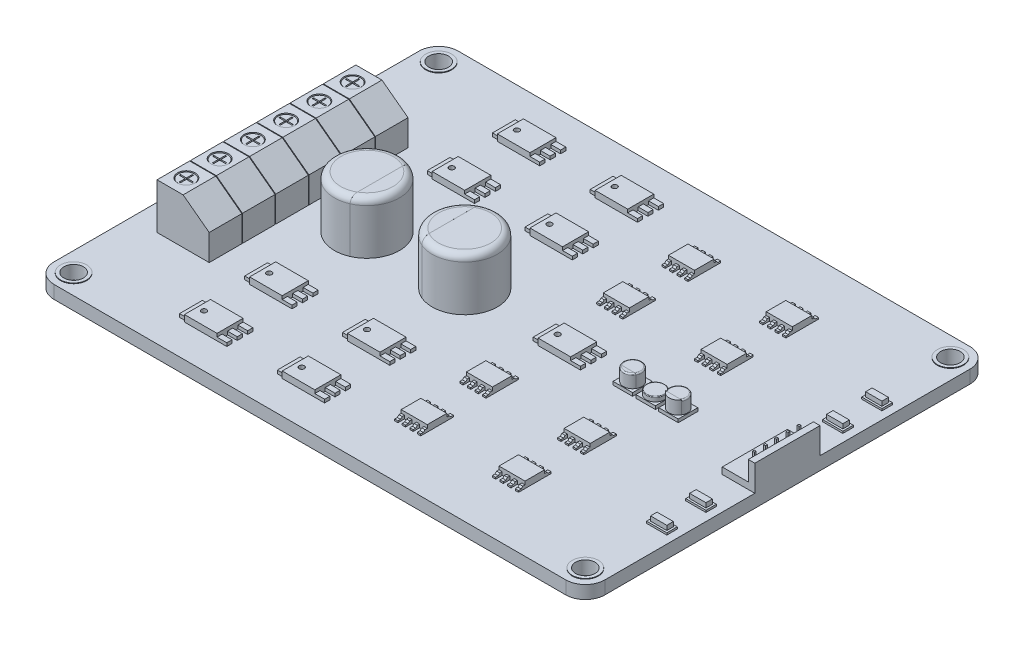
from build123d import *

# Parameters (mm, degrees)
SKETCH1_R                  = 1.5000000000000042
BOSS_EXTRUDE1_DEPTH        = 2
BOSS_EXTRUDE3_DEPTH        = 5
SKETCH9_R                  = 1.349999999999997
SKETCH9_R_2                = 1.2499999999999978
CUT_EXTRUDE2_DEPTH         = 2.5
SKETCH9_4_R                = 1.2499999999999978
CUT_EXTRUDE4_DEPTH         = 0.1
SKETCH9_3_W                = 2
SKETCH9_3_H                = 0.19999999999999973
CUT_EXTRUDE3_DEPTH         = 0.5
LPATTERN1_COUNT            = 3
LPATTERN1_PITCH            = 5.1
LPATTERN2_COUNT            = 4
LPATTERN2_PITCH            = 5.1
SKETCH10_R                 = 2.0000000000000036
SKETCH10_R_2               = 1.5000000000000042
BOSS_EXTRUDE4_DEPTH        = 0.1
SKETCH11_R                 = 5.000000000000001
SKETCH11_R_2               = 5
BOSS_EXTRUDE5_DEPTH        = 8
FILLET1_R                  = 1
SKETCH12_W                 = 5
SKETCH12_H                 = 4
SKETCH12_R                 = 0.4000000000000015
BOSS_EXTRUDE6_DEPTH        = 1
SKETCH12_3_W               = 1.5
SKETCH12_3_H               = 0.8009826220183172
SKETCH12_3_H_2             = 0.8000000000000007
BOSS_EXTRUDE7_DEPTH        = 0.5
SKETCH13_W                 = 3.5
SKETCH13_H                 = 0.5025199044534929
BOSS_EXTRUDE8_DEPTH        = 1
LPATTERN3_COUNT            = 2
LPATTERN3_PITCH            = 10
LPATTERN3_COUNT_DIR2       = 2
LPATTERN3_PITCH_DIR2       = 15
CUT_EXTRUDE5_START         = -8
CUT_EXTRUDE5_DEPTH         = 8
BOSS_EXTRUDE9_DEPTH        = 8
FILLET2_R                  = 1
SKETCH16_R                 = 0.3999999999999995
BOSS_EXTRUDE10_DEPTH       = 1
BOSS_EXTRUDE11_DEPTH       = 0.5
BOSS_EXTRUDE12_DEPTH       = 1
BOSS_EXTRUDE13_DEPTH       = 1
SKETCH18_3_W               = 0.5000000000000018
SKETCH18_3_H               = 1.0000000000000018
SKETCH18_3_W_2             = 0.5
SKETCH18_3_W_3             = 0.5000000000000027
SKETCH18_3_H_2             = 1.0000000000000036
SKETCH18_3_H_3             = 1
BOSS_EXTRUDE14_DEPTH       = 0.5
CUT_EXTRUDE6_REACH         = 62.725
LPATTERN4_COUNT            = 2
LPATTERN4_PITCH            = 10
LPATTERN4_COUNT_DIR2       = 2
LPATTERN4_PITCH_DIR2       = 15
SKETCH20_W                 = 3
SKETCH20_H                 = 3
BOSS_EXTRUDE15_DEPTH       = 0.5
LPATTERN5_COUNT            = 3
LPATTERN5_PITCH            = 3.5
SKETCH21_R                 = 1.399999999999999
BOSS_EXTRUDE16_DEPTH       = 2
CUT_EXTRUDE7_START         = -2
CUT_EXTRUDE7_DEPTH         = 2
BOSS_EXTRUDE17_START       = -2
BOSS_EXTRUDE17_DEPTH       = 2
FILLET3_R                  = 0.2
FILLET4_R                  = 0.2
LPATTERN6_COUNT            = 2
LPATTERN6_PITCH            = 7
FILLET4_OF_LPATTERN6_R     = 0.2
SKETCH24_R                 = 1.399999999999999
BOSS_EXTRUDE18_DEPTH       = 0.7
FILLET5_R                  = 0.1
SKETCH25_W                 = 4.999999999999993
SKETCH25_H                 = 10
BOSS_EXTRUDE19_DEPTH       = 1
SKETCH26_W                 = 1
SKETCH26_H                 = 9.999999999999996
BOSS_EXTRUDE20_DEPTH       = 3
SKETCH27_W                 = 0.29999999999999716
SKETCH27_H                 = 0.3000000000000016
SKETCH27_W_2               = 0.30000000000000426
SKETCH27_H_2               = 0.30000000000000226
SKETCH27_H_3               = 0.30000000000000204
SKETCH27_H_4               = 0.30000000000000293
BOSS_EXTRUDE21_DEPTH       = 3
SKETCH28_W                 = 2.5
SKETCH28_H                 = 1
BOSS_EXTRUDE22_DEPTH       = 1
SKETCH29_W                 = 3.1000000000000085
SKETCH29_H                 = 1.5999999999999979
BOSS_EXTRUDE23_DEPTH       = 0.3
LPATTERN7_COUNT            = 2
LPATTERN7_PITCH            = 6
MIRROR1_COPY_1_SKETCH_W    = 5
MIRROR1_COPY_1_SKETCH_H    = 4
MIRROR1_COPY_1_SKETCH_R    = 0.4000000000000015
MIRROR1_COPY_1_DEPTH       = 1
MIRROR1_COPY_2_SKETCH_W    = 5
MIRROR1_COPY_2_SKETCH_H    = 4
MIRROR1_COPY_2_SKETCH_R    = 0.4000000000000015
MIRROR1_COPY_2_DEPTH       = 1
MIRROR1_COPY_3_SKETCH_W    = 5
MIRROR1_COPY_3_SKETCH_H    = 4
MIRROR1_COPY_3_SKETCH_R    = 0.4000000000000015
MIRROR1_COPY_3_DEPTH       = 1
MIRROR1_COPY_4_SKETCH_W    = 1.5
MIRROR1_COPY_4_SKETCH_H    = 0.8009826220183172
MIRROR1_COPY_4_SKETCH_H_2  = 0.8000000000000007
MIRROR1_COPY_4_DEPTH       = 0.5
MIRROR1_COPY_5_SKETCH_W    = 1.5
MIRROR1_COPY_5_SKETCH_H    = 0.8009826220183172
MIRROR1_COPY_5_SKETCH_H_2  = 0.8000000000000007
MIRROR1_COPY_5_DEPTH       = 0.5
MIRROR1_COPY_6_SKETCH_W    = 1.5
MIRROR1_COPY_6_SKETCH_H    = 0.8009826220183172
MIRROR1_COPY_6_SKETCH_H_2  = 0.8000000000000007
MIRROR1_COPY_6_DEPTH       = 0.5
MIRROR1_COPY_7_SKETCH_W    = 3.5
MIRROR1_COPY_7_SKETCH_H    = 0.5025199044534929
MIRROR1_COPY_7_DEPTH       = 1
MIRROR1_COPY_8_SKETCH_W    = 3.5
MIRROR1_COPY_8_SKETCH_H    = 0.5025199044534929
MIRROR1_COPY_8_DEPTH       = 1
MIRROR1_COPY_9_SKETCH_W    = 3.5
MIRROR1_COPY_9_SKETCH_H    = 0.5025199044534929
MIRROR1_COPY_9_DEPTH       = 1
MIRROR1_COPY_10_DEPTH      = 1
MIRROR1_COPY_11_DEPTH      = 1
MIRROR1_COPY_12_DEPTH      = 1
MIRROR1_COPY_13_SKETCH_W   = 0.5000000000000018
MIRROR1_COPY_13_SKETCH_H   = 1.0000000000000018
MIRROR1_COPY_13_SKETCH_W_2 = 0.5
MIRROR1_COPY_13_SKETCH_W_3 = 0.5000000000000027
MIRROR1_COPY_13_SKETCH_H_2 = 1.0000000000000036
MIRROR1_COPY_13_SKETCH_H_3 = 1
MIRROR1_COPY_13_DEPTH      = 0.5
MIRROR1_COPY_14_SKETCH_W   = 0.5000000000000018
MIRROR1_COPY_14_SKETCH_H   = 1.0000000000000018
MIRROR1_COPY_14_SKETCH_W_2 = 0.5
MIRROR1_COPY_14_SKETCH_W_3 = 0.5000000000000027
MIRROR1_COPY_14_SKETCH_H_2 = 1.0000000000000036
MIRROR1_COPY_14_SKETCH_H_3 = 1
MIRROR1_COPY_14_DEPTH      = 0.5
MIRROR1_COPY_15_SKETCH_W   = 0.5000000000000018
MIRROR1_COPY_15_SKETCH_H   = 1.0000000000000018
MIRROR1_COPY_15_SKETCH_W_2 = 0.5
MIRROR1_COPY_15_SKETCH_W_3 = 0.5000000000000027
MIRROR1_COPY_15_SKETCH_H_2 = 1.0000000000000036
MIRROR1_COPY_15_SKETCH_H_3 = 1
MIRROR1_COPY_15_DEPTH      = 0.5
MIRROR1_COPY_16_REACH      = 62.725
MIRROR1_COPY_17_REACH      = 62.725
MIRROR1_COPY_18_REACH      = 62.725
MIRROR1_COPY_19_SKETCH_W   = 2.5
MIRROR1_COPY_19_SKETCH_H   = 1
MIRROR1_COPY_19_DEPTH      = 1
MIRROR1_COPY_20_SKETCH_W   = 3.1000000000000085
MIRROR1_COPY_20_SKETCH_H   = 1.5999999999999979
MIRROR1_COPY_20_DEPTH      = 0.3


# Read off the part's stored shape, not the designer's step: Boss-Extrude17
with BuildPart() as part:
    # Sketch1 → Boss-Extrude1 (new body)
    with BuildSketch(Plane(origin=(0, 0, 0), x_dir=(1, 0, 0), z_dir=(0, 1, 0))):
        with BuildLine():
            Line((39.250000000000014, -31), (-39.249999999999986, -31.000000000000014))
            ThreePointArc((-39.249999999999986, -31.000000000000014), (-41.37132034355963, -30.121320343559656), (-42.249999999999986, -28.00000000000001))
            Line((-42.249999999999986, -28.00000000000001), (-42.249999999999986, 27.99999999999999))
            ThreePointArc((-42.249999999999986, 27.99999999999999), (-41.371320343559624, 30.12132034355963), (-39.249999999999986, 30.999999999999986))
            Line((-39.249999999999986, 30.999999999999986), (39.250000000000014, 31))
            ThreePointArc((39.250000000000014, 31), (41.37132034355966, 30.121320343559645), (42.250000000000014, 28.000000000000004))
            Line((42.250000000000014, 28.000000000000004), (42.25000000000001, -27.999999999999996))
            ThreePointArc((42.25000000000001, -27.999999999999996), (41.37132034355966, -30.121320343559642), (39.250000000000014, -31))
        make_face()
        with Locations(Location((-39.24999999999999, 28, 0), (0, 0, 270))):
            Circle(SKETCH1_R, mode=Mode.SUBTRACT)
        with Locations(Location((39.25000000000001, 28, 0), (0, 0, 270))):
            Circle(SKETCH1_R, mode=Mode.SUBTRACT)
        with Locations(Location((39.25000000000001, -28, 0), (0, 0, 270))):
            Circle(SKETCH1_R, mode=Mode.SUBTRACT)
        with Locations(Location((-39.24999999999999, -28, 0), (0, 0, 270))):
            Circle(SKETCH1_R, mode=Mode.SUBTRACT)
    extrude(amount=BOSS_EXTRUDE1_DEPTH)

    # Sketch8 → Boss-Extrude3 (add)
    with BuildSketch(Plane.XY.offset(1)):
        Polygon((-38.24999999999999, 2), (-38.24999999999999, 9.000000000000002), (-34.249999999999986, 9.000000000000002), (-30.249999999999993, 6), (-30.249999999999993, 2), align=None)
    boss_extrude3 = extrude(amount=BOSS_EXTRUDE3_DEPTH)

    # Sketch9 → Cut-Extrude2 (cut)
    with BuildSketch(Plane(origin=(0, 9.000000000000002, 0), x_dir=(1, 0, 0), z_dir=(0, 1, 0))):
        with Locations(Location((-36.24999999999999, -3.5, 0), (0, 0, 270))):
            Circle(SKETCH9_R)
        with Locations(Location((-36.24999999999999, -3.5, 0), (0, 0, 270))):
            Circle(SKETCH9_R_2, mode=Mode.SUBTRACT)
    cut_extrude2 = extrude(amount=-CUT_EXTRUDE2_DEPTH, mode=Mode.SUBTRACT)

    # Sketch9<4> → Cut-Extrude4 (cut)
    with BuildSketch(Plane(origin=(0, 9.000000000000002, 0), x_dir=(1, 0, 0), z_dir=(0, 1, 0))):
        with Locations(Location((-36.24999999999999, -3.5, 0), (0, 0, 270))):
            Circle(SKETCH9_4_R)
    cut_extrude4 = extrude(amount=-CUT_EXTRUDE4_DEPTH, mode=Mode.SUBTRACT)

    # Sketch9<3> → Cut-Extrude3 (cut)
    with BuildSketch(Plane(origin=(0, 9.000000000000002, 0), x_dir=(1, 0, 0), z_dir=(0, 1, 0))):
        Polygon((-36.149999999999984, -4.500000000000001), (-36.149999999999984, -3.5), (-36.149999999999984, -2.5), (-36.349999999999994, -2.5), (-36.349999999999994, -3.5), (-36.349999999999994, -4.500000000000001), align=None)
        with Locations((-36.24999999999999, -3.5)):
            Rectangle(SKETCH9_3_W, SKETCH9_3_H)
    cut_extrude3 = extrude(amount=-CUT_EXTRUDE3_DEPTH, mode=Mode.SUBTRACT)

    # LPattern1: Boss-Extrude3, Cut-Extrude2, Cut-Extrude4, Cut-Extrude3 ×3
    with Locations(*[(0, 0, i * LPATTERN1_PITCH) for i in range(1, LPATTERN1_COUNT)]):
        add(boss_extrude3)
        add(cut_extrude2, mode=Mode.SUBTRACT)
        add(cut_extrude4, mode=Mode.SUBTRACT)
        add(cut_extrude3, mode=Mode.SUBTRACT)

    # LPattern2: Boss-Extrude3, Cut-Extrude2, Cut-Extrude4, Cut-Extrude3 ×4
    with Locations(*[(0, 0, -i * LPATTERN2_PITCH) for i in range(1, LPATTERN2_COUNT)]):
        add(boss_extrude3)
        add(cut_extrude2, mode=Mode.SUBTRACT)
        add(cut_extrude4, mode=Mode.SUBTRACT)
        add(cut_extrude3, mode=Mode.SUBTRACT)

    # Sketch10 → Boss-Extrude4 (add)
    # profile 1 of 4: a face of its own
    with BuildSketch(Plane(origin=(0, 2, 0), x_dir=(1, 0, 0), z_dir=(0, 1, 0))):
        with Locations(Location((-39.24999999999999, 28, 0), (0, 0, 90))):
            Circle(SKETCH10_R)
        with Locations(Location((-39.24999999999999, 28, 0), (0, 0, 270))):
            Circle(SKETCH10_R_2, mode=Mode.SUBTRACT)
    # profile 2 of 4: a face of its own
    with BuildSketch(Plane(origin=(0, 2, 0), x_dir=(1, 0, 0), z_dir=(0, 1, 0))):
        with Locations(Location((39.25000000000001, 28, 0), (0, 0, 90))):
            Circle(SKETCH10_R)
        with Locations(Location((39.25000000000001, 28, 0), (0, 0, 270))):
            Circle(SKETCH10_R_2, mode=Mode.SUBTRACT)
    # profile 3 of 4: a face of its own
    with BuildSketch(Plane(origin=(0, 2, 0), x_dir=(1, 0, 0), z_dir=(0, 1, 0))):
        with Locations(Location((39.25000000000001, -28, 0), (0, 0, 90))):
            Circle(SKETCH10_R)
        with Locations(Location((39.25000000000001, -28, 0), (0, 0, 270))):
            Circle(SKETCH10_R_2, mode=Mode.SUBTRACT)
    # profile 4 of 4: a face of its own
    with BuildSketch(Plane(origin=(0, 2, 0), x_dir=(1, 0, 0), z_dir=(0, 1, 0))):
        with Locations(Location((-39.24999999999999, -28, 0), (0, 0, 90))):
            Circle(SKETCH10_R)
        with Locations(Location((-39.24999999999999, -28, 0), (0, 0, 270))):
            Circle(SKETCH10_R_2, mode=Mode.SUBTRACT)
    extrude(amount=BOSS_EXTRUDE4_DEPTH)

    # Sketch11 → Boss-Extrude5 (add)
    with BuildSketch(Plane(origin=(0, 2, 0), x_dir=(1, 0, 0), z_dir=(0, 1, 0))):
        with Locations(Location((-22.249999999999982, 0, 0), (0, 0, 90))):
            Circle(SKETCH11_R)
        with Locations(Location((-7.249999999999982, 0, 0), (0, 0, 90))):
            Circle(SKETCH11_R_2)
    extrude(amount=BOSS_EXTRUDE5_DEPTH)

    # Fillet1
    fillet1_edges = [part.edges().sort_by_distance(p)[0] for p in [
        (-22.249999999999982, 10, 5.000000000000001),
        (-7.249999999999983, 10, 5),
    ]]
    fillet(fillet1_edges, radius=FILLET1_R)

    # Sketch12 → Boss-Extrude6 (add)
    with BuildSketch(Plane(origin=(0, 2, 0), x_dir=(1, 0, 0), z_dir=(0, 1, 0))):
        with Locations((-21.749999999999982, -14.000000000000014)):
            Rectangle(SKETCH12_W, SKETCH12_H)
        with Locations(Location((-23.249999999999982, -14.000000000000014, 0), (0, 0, 270))):
            Circle(SKETCH12_R, mode=Mode.SUBTRACT)
    boss_extrude6 = extrude(amount=BOSS_EXTRUDE6_DEPTH)

    # Sketch12<3> → Boss-Extrude7 (add)
    with BuildSketch(Plane(origin=(0, 2, 0), x_dir=(1, 0, 0), z_dir=(0, 1, 0))):
        with Locations((-18.499999999999982, -12.400491311009173)):
            Rectangle(SKETCH12_3_W, SKETCH12_3_H)
        Polygon((-19.249999999999982, -13.600982622018332), (-19.249999999999982, -14.400982622018333), (-17.749999999999986, -14.400982622018333), (-17.749999999999982, -13.600982622018332), align=None)
        with Locations((-18.499999999999982, -15.600000000000014)):
            Rectangle(SKETCH12_3_W, SKETCH12_3_H_2)
    boss_extrude7 = extrude(amount=BOSS_EXTRUDE7_DEPTH)

    # Sketch13 → Boss-Extrude8 (add)
    with BuildSketch(Plane.ZY.offset(24.249999999999982)):
        with Locations((14.000000000000014, 2.2512599522267465)):
            Rectangle(SKETCH13_W, SKETCH13_H)
    boss_extrude8 = extrude(amount=BOSS_EXTRUDE8_DEPTH)

    # LPattern3: Boss-Extrude6, Boss-Extrude7, Boss-Extrude8 2 × 2
    with Locations(*[(j * LPATTERN3_PITCH_DIR2, 0, i * LPATTERN3_PITCH) for i in range(LPATTERN3_COUNT) for j in range(LPATTERN3_COUNT_DIR2) if (i, j) != (0, 0)]):
        add(boss_extrude6)
        add(boss_extrude7)
        add(boss_extrude8)

    # Sketch14 → Cut-Extrude5 (cut)
    with BuildSketch(Plane(origin=(0, 10, 0), x_dir=(1, 0, 0), z_dir=(0, 1, 0)).offset(CUT_EXTRUDE5_START)):
        with BuildLine():
            ThreePointArc((-20.249999999999982, -4.582575694955841), (-17.249999999999982, 2.2e-16), (-20.249999999999982, 4.582575694955841))
            Line((-20.249999999999982, 4.582575694955842), (-20.249999999999982, -4.582575694955842))
        make_face()
        with BuildLine():
            Line((-9.249999999999979, -4.582575694955842), (-9.249999999999979, 4.582575694955842))
            ThreePointArc((-9.249999999999979, 4.582575694955842), (-12.249999999999982, 6.1e-16), (-9.249999999999979, -4.582575694955842))
        make_face()
    extrude(amount=CUT_EXTRUDE5_DEPTH, mode=Mode.SUBTRACT)

    # Sketch15 → Boss-Extrude9 (add)
    with BuildSketch(Plane(origin=(0, 2, 0), x_dir=(1, 0, 0), z_dir=(0, 1, 0))):
        with BuildLine():
            ThreePointArc((-17.249999999999982, 0), (-18.06640107084818, 2.7381563140185943), (-20.248999999999942, 4.582139129271375))
            Line((-20.24899999999998, 4.582139129271363), (-20.24899999999998, -4.582139129271362))
            ThreePointArc((-20.248999999999945, -4.5821391292713765), (-18.06640107084818, -2.738156314018595), (-17.249999999999982, -1.22e-15))
        make_face()
        with BuildLine():
            Line((-9.250999999999976, -4.58213912927144), (-9.250999999999978, 4.582139129271438))
            ThreePointArc((-9.250999999999923, 4.582139129271419), (-12.249999999999982, 6.1e-16), (-9.25099999999992, -4.58213912927142))
        make_face()
    extrude(amount=BOSS_EXTRUDE9_DEPTH)

    # Fillet2
    fillet2_edges = [part.edges().sort_by_distance(p)[0] for p in [
        (-17.249999999999982, 10, 3.11e-15),
        (-12.249999999999982, 10, 1.11e-15),
    ]]
    fillet(fillet2_edges, radius=FILLET2_R)

    # Sketch16 → Boss-Extrude10 (add)
    with BuildSketch(Plane(origin=(0, 2, 0), x_dir=(1, 0, 0), z_dir=(0, 1, 0))):
        Polygon((6, -2), (11.000000000000002, -2), (11.000000000000002, 2.0000000000000018), (5.999999999999999, 2), align=None)
        with Locations(Location((7, 0, 0), (0, 0, 270))):
            Circle(SKETCH16_R, mode=Mode.SUBTRACT)
    extrude(amount=BOSS_EXTRUDE10_DEPTH)

    # Sketch16<3> → Boss-Extrude11 (add)
    with BuildSketch(Plane(origin=(0, 2, 0), x_dir=(1, 0, 0), z_dir=(0, 1, 0))):
        Polygon((12.5, 2.0000000000000027), (11.000000000000002, 2.0000000000000018), (11.000000000000002, 1.200000000000002), (12.5, 1.2000000000000026), align=None)
        Polygon((11.000000000000002, 0.400000000000003), (11.000000000000002, -0.39999999999999725), (12.5, -0.39999999999999714), (12.5, 0.4000000000000028), align=None)
        Polygon((11.000000000000002, -1.1999999999999973), (11.000000000000002, -2), (12.5, -2), (12.5, -1.1999999999999966), align=None)
    extrude(amount=BOSS_EXTRUDE11_DEPTH)

    # Sketch17 → Boss-Extrude12 (add)
    with BuildSketch(Plane.ZY.offset(-6)):
        Polygon((-1.7500000000000002, 1.9999999999999996), (1.7500000000000002, 1.9999999999999996), (1.7500000000000002, 2.4999999999999996), (-1.7499999999999998, 2.4999999999999996), align=None)
    extrude(amount=BOSS_EXTRUDE12_DEPTH)

    # Sketch18 → Boss-Extrude13 (add)
    with BuildSketch(Plane(origin=(0, 2, 0), x_dir=(1, 0, 0), z_dir=(0, 1, 0))):
        Polygon((9.000000000000002, -9), (9.000000000000002, -12), (5.000000000000001, -11.999999999999998), (5.000000000000001, -9), align=None)
    boss_extrude13 = extrude(amount=BOSS_EXTRUDE13_DEPTH)

    # Sketch18<3> → Boss-Extrude14 (add)
    with BuildSketch(Plane(origin=(0, 2, 0), x_dir=(1, 0, 0), z_dir=(0, 1, 0))):
        with Locations((8.75, -12.5)):
            Rectangle(SKETCH18_3_W, SKETCH18_3_H)
        with Locations((7.583333333333334, -12.5)):
            Rectangle(SKETCH18_3_W_2, SKETCH18_3_H)
        with Locations((6.413333333333334, -12.5)):
            Rectangle(SKETCH18_3_W_3, SKETCH18_3_H_2)
        with Locations((5.250000000000002, -12.5)):
            Rectangle(SKETCH18_3_W, SKETCH18_3_H_2)
        Polygon((8.5, -7.999999999999998), (8.5, -9), (9.000000000000002, -9), (9.000000000000002, -8), align=None)
        with Locations((7.583333333333334, -8.5)):
            Rectangle(SKETCH18_3_W_2, SKETCH18_3_H_3)
        Polygon((6.163333333333333, -8), (6.163333333333333, -9), (6.663333333333335, -9), (6.663333333333334, -8), align=None)
        Polygon((5.000000000000001, -8), (5.000000000000001, -9), (5.500000000000003, -9), (5.500000000000002, -8), align=None)
    boss_extrude14 = extrude(amount=BOSS_EXTRUDE14_DEPTH)

    # Cut-Extrude6: up to this face of the body (flat: up to its plane)
    cut_extrude6_end = Plane(part.part.faces().sort_by_distance((5, 2.25, 0))[0])
    # Sketch19 → Cut-Extrude6 (cut, up to the picked face)
    with BuildSketch(Plane(origin=(9.000000000000002, 0, 0), x_dir=(0, 0, -1), z_dir=(1, 0, 0)), mode=Mode.PRIVATE) as cut_extrude6_sk1:
        Polygon((-12.347582855807117, 2.499999999999999), (-13, 2.5), (-13, 2.2500000000000004), (-12.597582855807117, 2.2500000000000004), align=None)
    cut_extrude6_tool1 = split(extrude(cut_extrude6_sk1.sketch, amount=-CUT_EXTRUDE6_REACH, mode=Mode.PRIVATE), bisect_by=cut_extrude6_end, keep=Keep.BOTH, mode=Mode.PRIVATE)
    # Sketch19 → Cut-Extrude6 (cut, up to the picked face)
    with BuildSketch(Plane(origin=(9.000000000000002, 0, 0), x_dir=(0, 0, -1), z_dir=(1, 0, 0)), mode=Mode.PRIVATE) as cut_extrude6_sk2:
        Polygon((-8.652417144192881, 2.499999999999999), (-8.40241714419288, 2.250000000000001), (-7.999999999999998, 2.250000000000001), (-8, 2.5000000000000013), align=None)
    cut_extrude6_tool2 = split(extrude(cut_extrude6_sk2.sketch, amount=-CUT_EXTRUDE6_REACH, mode=Mode.PRIVATE), bisect_by=cut_extrude6_end, keep=Keep.BOTH, mode=Mode.PRIVATE)
    cut_extrude6_1 = cut_extrude6_tool1.solids().sort_by(Axis((9, 2.384875, 12.731354), (-1, 0, 0)))[0]
    add(cut_extrude6_1, mode=Mode.SUBTRACT)
    cut_extrude6_2 = cut_extrude6_tool2.solids().sort_by(Axis((9, 2.384875, 8.268646), (-1, 0, 0)))[0]
    add(cut_extrude6_2, mode=Mode.SUBTRACT)
    cut_extrude6 = cut_extrude6_1 + cut_extrude6_2  # Cut-Extrude6 as one shape, for the pattern or mirror that repeats it

    # LPattern4: Boss-Extrude13, Boss-Extrude14, Cut-Extrude6 2 × 2
    with Locations(*[(j * LPATTERN4_PITCH_DIR2, 0, i * LPATTERN4_PITCH) for i in range(LPATTERN4_COUNT) for j in range(LPATTERN4_COUNT_DIR2) if (i, j) != (0, 0)]):
        add(boss_extrude13)
        add(boss_extrude14)
        add(cut_extrude6, mode=Mode.SUBTRACT)

    # Sketch20 → Boss-Extrude15 (add)
    with BuildSketch(Plane(origin=(0, 2, 0), x_dir=(1, 0, 0), z_dir=(0, 1, 0))):
        with Locations((18.5, 0)):
            Rectangle(SKETCH20_W, SKETCH20_H)
    boss_extrude15 = extrude(amount=BOSS_EXTRUDE15_DEPTH)

    # LPattern5: Boss-Extrude15 ×3
    with Locations(*[(i * LPATTERN5_PITCH, 0, 0) for i in range(1, LPATTERN5_COUNT)]):
        add(boss_extrude15)

    # Sketch21 → Boss-Extrude16 (add)
    with BuildSketch(Plane(origin=(0, 2.5, 0), x_dir=(1, 0, 0), z_dir=(0, 1, 0))):
        with Locations(Location((18.5, 0, 0), (0, 0, 270))):
            Circle(SKETCH21_R)
    boss_extrude16 = extrude(amount=BOSS_EXTRUDE16_DEPTH)

    # Sketch22 → Cut-Extrude7 (cut)
    with BuildSketch(Plane(origin=(0, 4.500000000000001, 0), x_dir=(1, 0, 0), z_dir=(0, 1, 0)).offset(CUT_EXTRUDE7_START)):
        with BuildLine():
            Line((19.71243556529821, -0.6999999999999993), (17.287564434701785, -0.6999999999999993))
            ThreePointArc((17.287564434701785, -0.6999999999999987), (18.5, -1.3999999999999992), (19.712435565298215, -0.7000000000000003))
        make_face()
    cut_extrude7 = extrude(amount=CUT_EXTRUDE7_DEPTH, mode=Mode.SUBTRACT)

    # Boss-Extrude17 outline → Boss-Extrude17 (add)
    with BuildSketch(Plane(origin=(0, 4.500000000000001, 0), x_dir=(1, 0, 0), z_dir=(0, 1, 0)).offset(BOSS_EXTRUDE17_START)):
        with BuildLine():
            Line((19.711857665, -0.701), (17.288142335, -0.701))
            ThreePointArc((17.288142335, -0.701), (18.5, -1.4), (19.711857665, -0.701))
        make_face()
    boss_extrude17 = extrude(amount=BOSS_EXTRUDE17_DEPTH)

    # Fillet3
    fillet3_edges = [part.edges().sort_by_distance(p)[0] for p in [
        (18.5, 4.500000000000001, 1.4000000000000008),
    ]]
    fillet(fillet3_edges, radius=FILLET3_R)

    # Fillet4
    fillet4_edges = [part.edges().sort_by_distance(p)[0] for p in [
        (18.5, 4.5, -1.399999999999999),
    ]]
    fillet(fillet4_edges, radius=FILLET4_R)

    # LPattern6: Boss-Extrude16, Cut-Extrude7, Boss-Extrude17 ×2
    with Locations(*[(i * LPATTERN6_PITCH, 0, 0) for i in range(1, LPATTERN6_COUNT)]):
        add(boss_extrude16)
        add(cut_extrude7, mode=Mode.SUBTRACT)
        add(boss_extrude17)

    # Fillet4 of LPattern6
    fillet4_of_lpattern6_edges = [part.edges().sort_by_distance(p)[0] for p in [
        (25.5, 4.5, -1.399999999999999),
    ]]
    fillet(fillet4_of_lpattern6_edges, radius=FILLET4_OF_LPATTERN6_R)

    # Sketch24 → Boss-Extrude18 (add)
    with BuildSketch(Plane(origin=(0, 2.5, 0), x_dir=(1, 0, 0), z_dir=(0, 1, 0))):
        with Locations(Location((22, 0, 0), (0, 0, 270))):
            Circle(SKETCH24_R)
    extrude(amount=BOSS_EXTRUDE18_DEPTH)

    # Fillet5
    fillet5_edges = [part.edges().sort_by_distance(p)[0] for p in [
        (22, 3.2, -1.399999999999999),
    ]]
    fillet(fillet5_edges, radius=FILLET5_R)

    # Sketch25 → Boss-Extrude19 (add)
    with BuildSketch(Plane(origin=(0, 2, 0), x_dir=(1, 0, 0), z_dir=(0, 1, 0))):
        with Locations((39.750000000000014, 0)):
            Rectangle(SKETCH25_W, SKETCH25_H)
    extrude(amount=BOSS_EXTRUDE19_DEPTH)

    # Sketch26 → Boss-Extrude20 (add)
    with BuildSketch(Plane(origin=(0, 3, 0), x_dir=(1, 0, 0), z_dir=(0, 1, 0))):
        with Locations((41.75000000000001, 1.33e-15)):
            Rectangle(SKETCH26_W, SKETCH26_H)
    extrude(amount=BOSS_EXTRUDE20_DEPTH)

    # Sketch27 → Boss-Extrude21 (add)
    with BuildSketch(Plane(origin=(0, 3, 0), x_dir=(1, 0, 0), z_dir=(0, 1, 0))):
        with Locations((40.60000000000001, 3.4299999999999993)):
            Rectangle(SKETCH27_W, SKETCH27_H)
        with Locations((40.60000000000002, 1.7133333333333307)):
            Rectangle(SKETCH27_W_2, SKETCH27_H_2)
        with Locations((40.60000000000004, -0.00333333333333848)):
            Rectangle(SKETCH27_W_2, SKETCH27_H_3)
        with Locations((40.600000000000065, -1.7200000000000077)):
            Rectangle(SKETCH27_W_2, SKETCH27_H_3)
        with Locations((40.60000000000008, -3.4366666666666763)):
            Rectangle(SKETCH27_W_2, SKETCH27_H_4)
    extrude(amount=BOSS_EXTRUDE21_DEPTH)

    # Sketch28 → Boss-Extrude22 (add)
    with BuildSketch(Plane(origin=(0, 2, 0), x_dir=(1, 0, 0), z_dir=(0, 1, 0))):
        with Locations((39.50000000000001, -10.5)):
            Rectangle(SKETCH28_W, SKETCH28_H)
    boss_extrude22 = extrude(amount=BOSS_EXTRUDE22_DEPTH)

    # Sketch29 → Boss-Extrude23 (add)
    with BuildSketch(Plane(origin=(0, 2, 0), x_dir=(1, 0, 0), z_dir=(0, 1, 0))):
        with Locations((39.50000000000001, -10.5)):
            Rectangle(SKETCH29_W, SKETCH29_H)
    boss_extrude23 = extrude(amount=BOSS_EXTRUDE23_DEPTH)

    # LPattern7: Boss-Extrude22, Boss-Extrude23 ×2
    with Locations(*[(0, 0, i * LPATTERN7_PITCH) for i in range(1, LPATTERN7_COUNT)]):
        add(boss_extrude22)
        add(boss_extrude23)

    # Mirror1: Boss-Extrude6, Boss-Extrude7, Boss-Extrude8, Boss-Extrude13, Boss-Extrude14, Cut-Extrude6, Boss-Extrude22, Boss-Extrude23 across plane
    add(boss_extrude6.mirror(Plane.XY))
    add(boss_extrude7.mirror(Plane.XY))
    add(boss_extrude8.mirror(Plane.XY))
    add(boss_extrude13.mirror(Plane.XY))
    add(boss_extrude14.mirror(Plane.XY))
    add(cut_extrude6.mirror(Plane.XY), mode=Mode.SUBTRACT)
    add(boss_extrude22.mirror(Plane.XY))
    add(boss_extrude23.mirror(Plane.XY))

    # Mirror1 copy 1 sketch → Mirror1 copy 1 (add)
    with BuildSketch(Plane(origin=(15, 2, 0), x_dir=(1, 0, 0), z_dir=(0, 1, 0))):
        with Locations((-21.749999999999982, 14.000000000000014)):
            Rectangle(MIRROR1_COPY_1_SKETCH_W, MIRROR1_COPY_1_SKETCH_H)
        with Locations((-23.249999999999982, 14.000000000000014)):
            Circle(MIRROR1_COPY_1_SKETCH_R, mode=Mode.SUBTRACT)
    extrude(amount=MIRROR1_COPY_1_DEPTH)

    # Mirror1 copy 2 sketch → Mirror1 copy 2 (add)
    with BuildSketch(Plane(origin=(0, 2, -10), x_dir=(1, 0, 0), z_dir=(0, 1, 0))):
        with Locations((-21.749999999999982, 14.000000000000014)):
            Rectangle(MIRROR1_COPY_2_SKETCH_W, MIRROR1_COPY_2_SKETCH_H)
        with Locations((-23.249999999999982, 14.000000000000014)):
            Circle(MIRROR1_COPY_2_SKETCH_R, mode=Mode.SUBTRACT)
    extrude(amount=MIRROR1_COPY_2_DEPTH)

    # Mirror1 copy 3 sketch → Mirror1 copy 3 (add)
    with BuildSketch(Plane(origin=(15, 2, -10), x_dir=(1, 0, 0), z_dir=(0, 1, 0))):
        with Locations((-21.749999999999982, 14.000000000000014)):
            Rectangle(MIRROR1_COPY_3_SKETCH_W, MIRROR1_COPY_3_SKETCH_H)
        with Locations((-23.249999999999982, 14.000000000000014)):
            Circle(MIRROR1_COPY_3_SKETCH_R, mode=Mode.SUBTRACT)
    extrude(amount=MIRROR1_COPY_3_DEPTH)

    # Mirror1 copy 4 sketch → Mirror1 copy 4 (add)
    with BuildSketch(Plane(origin=(15, 2, 0), x_dir=(1, 0, 0), z_dir=(0, 1, 0))):
        with Locations((-18.499999999999982, 12.400491311009173)):
            Rectangle(MIRROR1_COPY_4_SKETCH_W, MIRROR1_COPY_4_SKETCH_H)
        Polygon((-19.249999999999982, 13.600982622018332), (-19.249999999999982, 14.400982622018333), (-17.749999999999986, 14.400982622018333), (-17.749999999999982, 13.600982622018332), align=None)
        with Locations((-18.499999999999982, 15.600000000000014)):
            Rectangle(MIRROR1_COPY_4_SKETCH_W, MIRROR1_COPY_4_SKETCH_H_2)
    extrude(amount=MIRROR1_COPY_4_DEPTH)

    # Mirror1 copy 5 sketch → Mirror1 copy 5 (add)
    with BuildSketch(Plane(origin=(0, 2, -10), x_dir=(1, 0, 0), z_dir=(0, 1, 0))):
        with Locations((-18.499999999999982, 12.400491311009173)):
            Rectangle(MIRROR1_COPY_5_SKETCH_W, MIRROR1_COPY_5_SKETCH_H)
        Polygon((-19.249999999999982, 13.600982622018332), (-19.249999999999982, 14.400982622018333), (-17.749999999999986, 14.400982622018333), (-17.749999999999982, 13.600982622018332), align=None)
        with Locations((-18.499999999999982, 15.600000000000014)):
            Rectangle(MIRROR1_COPY_5_SKETCH_W, MIRROR1_COPY_5_SKETCH_H_2)
    extrude(amount=MIRROR1_COPY_5_DEPTH)

    # Mirror1 copy 6 sketch → Mirror1 copy 6 (add)
    with BuildSketch(Plane(origin=(15, 2, -10), x_dir=(1, 0, 0), z_dir=(0, 1, 0))):
        with Locations((-18.499999999999982, 12.400491311009173)):
            Rectangle(MIRROR1_COPY_6_SKETCH_W, MIRROR1_COPY_6_SKETCH_H)
        Polygon((-19.249999999999982, 13.600982622018332), (-19.249999999999982, 14.400982622018333), (-17.749999999999986, 14.400982622018333), (-17.749999999999982, 13.600982622018332), align=None)
        with Locations((-18.499999999999982, 15.600000000000014)):
            Rectangle(MIRROR1_COPY_6_SKETCH_W, MIRROR1_COPY_6_SKETCH_H_2)
    extrude(amount=MIRROR1_COPY_6_DEPTH)

    # Mirror1 copy 7 sketch → Mirror1 copy 7 (add)
    with BuildSketch(Plane(origin=(-9.249999999999982, 0, 0), x_dir=(0, 0, -1), z_dir=(-1, 0, 0))):
        with Locations((14.000000000000014, -2.2512599522267465)):
            Rectangle(MIRROR1_COPY_7_SKETCH_W, MIRROR1_COPY_7_SKETCH_H)
    extrude(amount=MIRROR1_COPY_7_DEPTH)

    # Mirror1 copy 8 sketch → Mirror1 copy 8 (add)
    with BuildSketch(Plane(origin=(-24.249999999999982, 0, -10), x_dir=(0, 0, -1), z_dir=(-1, 0, 0))):
        with Locations((14.000000000000014, -2.2512599522267465)):
            Rectangle(MIRROR1_COPY_8_SKETCH_W, MIRROR1_COPY_8_SKETCH_H)
    extrude(amount=MIRROR1_COPY_8_DEPTH)

    # Mirror1 copy 9 sketch → Mirror1 copy 9 (add)
    with BuildSketch(Plane(origin=(-9.249999999999982, 0, -10), x_dir=(0, 0, -1), z_dir=(-1, 0, 0))):
        with Locations((14.000000000000014, -2.2512599522267465)):
            Rectangle(MIRROR1_COPY_9_SKETCH_W, MIRROR1_COPY_9_SKETCH_H)
    extrude(amount=MIRROR1_COPY_9_DEPTH)

    # Mirror1 copy 10 sketch → Mirror1 copy 10 (add)
    with BuildSketch(Plane(origin=(15, 2, 0), x_dir=(1, 0, 0), z_dir=(0, 1, 0))):
        Polygon((9.000000000000002, 9), (9.000000000000002, 12), (5.000000000000001, 11.999999999999998), (5.000000000000001, 9), align=None)
    extrude(amount=MIRROR1_COPY_10_DEPTH)

    # Mirror1 copy 11 sketch → Mirror1 copy 11 (add)
    with BuildSketch(Plane(origin=(0, 2, -10), x_dir=(1, 0, 0), z_dir=(0, 1, 0))):
        Polygon((9.000000000000002, 9), (9.000000000000002, 12), (5.000000000000001, 11.999999999999998), (5.000000000000001, 9), align=None)
    extrude(amount=MIRROR1_COPY_11_DEPTH)

    # Mirror1 copy 12 sketch → Mirror1 copy 12 (add)
    with BuildSketch(Plane(origin=(15, 2, -10), x_dir=(1, 0, 0), z_dir=(0, 1, 0))):
        Polygon((9.000000000000002, 9), (9.000000000000002, 12), (5.000000000000001, 11.999999999999998), (5.000000000000001, 9), align=None)
    extrude(amount=MIRROR1_COPY_12_DEPTH)

    # Mirror1 copy 13 sketch → Mirror1 copy 13 (add)
    with BuildSketch(Plane(origin=(15, 2, 0), x_dir=(1, 0, 0), z_dir=(0, 1, 0))):
        with Locations((8.75, 12.5)):
            Rectangle(MIRROR1_COPY_13_SKETCH_W, MIRROR1_COPY_13_SKETCH_H)
        with Locations((7.583333333333334, 12.5)):
            Rectangle(MIRROR1_COPY_13_SKETCH_W_2, MIRROR1_COPY_13_SKETCH_H)
        with Locations((6.413333333333334, 12.5)):
            Rectangle(MIRROR1_COPY_13_SKETCH_W_3, MIRROR1_COPY_13_SKETCH_H_2)
        with Locations((5.250000000000002, 12.5)):
            Rectangle(MIRROR1_COPY_13_SKETCH_W, MIRROR1_COPY_13_SKETCH_H_2)
        Polygon((8.5, 7.999999999999998), (8.5, 9), (9.000000000000002, 9), (9.000000000000002, 8), align=None)
        with Locations((7.583333333333334, 8.5)):
            Rectangle(MIRROR1_COPY_13_SKETCH_W_2, MIRROR1_COPY_13_SKETCH_H_3)
        Polygon((6.163333333333333, 8), (6.163333333333333, 9), (6.663333333333335, 9), (6.663333333333334, 8), align=None)
        Polygon((5.000000000000001, 8), (5.000000000000001, 9), (5.500000000000003, 9), (5.500000000000002, 8), align=None)
    extrude(amount=MIRROR1_COPY_13_DEPTH)

    # Mirror1 copy 14 sketch → Mirror1 copy 14 (add)
    with BuildSketch(Plane(origin=(0, 2, -10), x_dir=(1, 0, 0), z_dir=(0, 1, 0))):
        with Locations((8.75, 12.5)):
            Rectangle(MIRROR1_COPY_14_SKETCH_W, MIRROR1_COPY_14_SKETCH_H)
        with Locations((7.583333333333334, 12.5)):
            Rectangle(MIRROR1_COPY_14_SKETCH_W_2, MIRROR1_COPY_14_SKETCH_H)
        with Locations((6.413333333333334, 12.5)):
            Rectangle(MIRROR1_COPY_14_SKETCH_W_3, MIRROR1_COPY_14_SKETCH_H_2)
        with Locations((5.250000000000002, 12.5)):
            Rectangle(MIRROR1_COPY_14_SKETCH_W, MIRROR1_COPY_14_SKETCH_H_2)
        Polygon((8.5, 7.999999999999998), (8.5, 9), (9.000000000000002, 9), (9.000000000000002, 8), align=None)
        with Locations((7.583333333333334, 8.5)):
            Rectangle(MIRROR1_COPY_14_SKETCH_W_2, MIRROR1_COPY_14_SKETCH_H_3)
        Polygon((6.163333333333333, 8), (6.163333333333333, 9), (6.663333333333335, 9), (6.663333333333334, 8), align=None)
        Polygon((5.000000000000001, 8), (5.000000000000001, 9), (5.500000000000003, 9), (5.500000000000002, 8), align=None)
    extrude(amount=MIRROR1_COPY_14_DEPTH)

    # Mirror1 copy 15 sketch → Mirror1 copy 15 (add)
    with BuildSketch(Plane(origin=(15, 2, -10), x_dir=(1, 0, 0), z_dir=(0, 1, 0))):
        with Locations((8.75, 12.5)):
            Rectangle(MIRROR1_COPY_15_SKETCH_W, MIRROR1_COPY_15_SKETCH_H)
        with Locations((7.583333333333334, 12.5)):
            Rectangle(MIRROR1_COPY_15_SKETCH_W_2, MIRROR1_COPY_15_SKETCH_H)
        with Locations((6.413333333333334, 12.5)):
            Rectangle(MIRROR1_COPY_15_SKETCH_W_3, MIRROR1_COPY_15_SKETCH_H_2)
        with Locations((5.250000000000002, 12.5)):
            Rectangle(MIRROR1_COPY_15_SKETCH_W, MIRROR1_COPY_15_SKETCH_H_2)
        Polygon((8.5, 7.999999999999998), (8.5, 9), (9.000000000000002, 9), (9.000000000000002, 8), align=None)
        with Locations((7.583333333333334, 8.5)):
            Rectangle(MIRROR1_COPY_15_SKETCH_W_2, MIRROR1_COPY_15_SKETCH_H_3)
        Polygon((6.163333333333333, 8), (6.163333333333333, 9), (6.663333333333335, 9), (6.663333333333334, 8), align=None)
        Polygon((5.000000000000001, 8), (5.000000000000001, 9), (5.500000000000003, 9), (5.500000000000002, 8), align=None)
    extrude(amount=MIRROR1_COPY_15_DEPTH)

    # Mirror1 copy 16: up to this face of the body (flat: up to its plane)
    mirror1_copy_16_end = Plane(part.part.faces().sort_by_distance((20, 2.25, 0))[0])
    # Mirror1 copy 16 sketch → Mirror1 copy 16 (cut, up to the picked face)
    with BuildSketch(Plane(origin=(24, 0, 0), x_dir=(0, 0, 1), z_dir=(1, 0, 0)), mode=Mode.PRIVATE) as mirror1_copy_16_sk1:
        Polygon((-12.347582855807117, -2.499999999999999), (-13, -2.5), (-13, -2.2500000000000004), (-12.597582855807117, -2.2500000000000004), align=None)
    mirror1_copy_16_tool1 = split(extrude(mirror1_copy_16_sk1.sketch, amount=-MIRROR1_COPY_16_REACH, mode=Mode.PRIVATE), bisect_by=mirror1_copy_16_end, keep=Keep.BOTH, mode=Mode.PRIVATE)
    # Mirror1 copy 16 sketch → Mirror1 copy 16 (cut, up to the picked face)
    with BuildSketch(Plane(origin=(24, 0, 0), x_dir=(0, 0, 1), z_dir=(1, 0, 0)), mode=Mode.PRIVATE) as mirror1_copy_16_sk2:
        Polygon((-8.652417144192881, -2.499999999999999), (-8.40241714419288, -2.250000000000001), (-7.999999999999998, -2.250000000000001), (-8, -2.5000000000000013), align=None)
    mirror1_copy_16_tool2 = split(extrude(mirror1_copy_16_sk2.sketch, amount=-MIRROR1_COPY_16_REACH, mode=Mode.PRIVATE), bisect_by=mirror1_copy_16_end, keep=Keep.BOTH, mode=Mode.PRIVATE)
    add(mirror1_copy_16_tool1.solids().sort_by(Axis((24, 2.384875, -12.731354), (-1, 0, 0)))[0], mode=Mode.SUBTRACT)
    add(mirror1_copy_16_tool2.solids().sort_by(Axis((24, 2.384875, -8.268646), (-1, 0, 0)))[0], mode=Mode.SUBTRACT)

    # Mirror1 copy 17: up to this face of the body (flat: up to its plane)
    mirror1_copy_17_end = Plane(part.part.faces().sort_by_distance((5, 2.25, -10))[0])
    # Mirror1 copy 17 sketch → Mirror1 copy 17 (cut, up to the picked face)
    with BuildSketch(Plane(origin=(9.000000000000002, 7e-17, -10), x_dir=(0, 0, 1), z_dir=(1, 0, 0)), mode=Mode.PRIVATE) as mirror1_copy_17_sk1:
        Polygon((-12.347582855807117, -2.499999999999999), (-13, -2.5), (-13, -2.2500000000000004), (-12.597582855807117, -2.2500000000000004), align=None)
    mirror1_copy_17_tool1 = split(extrude(mirror1_copy_17_sk1.sketch, amount=-MIRROR1_COPY_17_REACH, mode=Mode.PRIVATE), bisect_by=mirror1_copy_17_end, keep=Keep.BOTH, mode=Mode.PRIVATE)
    # Mirror1 copy 17 sketch → Mirror1 copy 17 (cut, up to the picked face)
    with BuildSketch(Plane(origin=(9.000000000000002, 7e-17, -10), x_dir=(0, 0, 1), z_dir=(1, 0, 0)), mode=Mode.PRIVATE) as mirror1_copy_17_sk2:
        Polygon((-8.652417144192881, -2.499999999999999), (-8.40241714419288, -2.250000000000001), (-7.999999999999998, -2.250000000000001), (-8, -2.5000000000000013), align=None)
    mirror1_copy_17_tool2 = split(extrude(mirror1_copy_17_sk2.sketch, amount=-MIRROR1_COPY_17_REACH, mode=Mode.PRIVATE), bisect_by=mirror1_copy_17_end, keep=Keep.BOTH, mode=Mode.PRIVATE)
    add(mirror1_copy_17_tool1.solids().sort_by(Axis((9, 2.384875, -22.731354), (-1, 0, 0)))[0], mode=Mode.SUBTRACT)
    add(mirror1_copy_17_tool2.solids().sort_by(Axis((9, 2.384875, -18.268646), (-1, 0, 0)))[0], mode=Mode.SUBTRACT)

    # Mirror1 copy 18: up to this face of the body (flat: up to its plane)
    mirror1_copy_18_end = Plane(part.part.faces().sort_by_distance((20, 2.25, -10))[0])
    # Mirror1 copy 18 sketch → Mirror1 copy 18 (cut, up to the picked face)
    with BuildSketch(Plane(origin=(24, 7e-17, -10), x_dir=(0, 0, 1), z_dir=(1, 0, 0)), mode=Mode.PRIVATE) as mirror1_copy_18_sk1:
        Polygon((-12.347582855807117, -2.499999999999999), (-13, -2.5), (-13, -2.2500000000000004), (-12.597582855807117, -2.2500000000000004), align=None)
    mirror1_copy_18_tool1 = split(extrude(mirror1_copy_18_sk1.sketch, amount=-MIRROR1_COPY_18_REACH, mode=Mode.PRIVATE), bisect_by=mirror1_copy_18_end, keep=Keep.BOTH, mode=Mode.PRIVATE)
    # Mirror1 copy 18 sketch → Mirror1 copy 18 (cut, up to the picked face)
    with BuildSketch(Plane(origin=(24, 7e-17, -10), x_dir=(0, 0, 1), z_dir=(1, 0, 0)), mode=Mode.PRIVATE) as mirror1_copy_18_sk2:
        Polygon((-8.652417144192881, -2.499999999999999), (-8.40241714419288, -2.250000000000001), (-7.999999999999998, -2.250000000000001), (-8, -2.5000000000000013), align=None)
    mirror1_copy_18_tool2 = split(extrude(mirror1_copy_18_sk2.sketch, amount=-MIRROR1_COPY_18_REACH, mode=Mode.PRIVATE), bisect_by=mirror1_copy_18_end, keep=Keep.BOTH, mode=Mode.PRIVATE)
    add(mirror1_copy_18_tool1.solids().sort_by(Axis((24, 2.384875, -22.731354), (-1, 0, 0)))[0], mode=Mode.SUBTRACT)
    add(mirror1_copy_18_tool2.solids().sort_by(Axis((24, 2.384875, -18.268646), (-1, 0, 0)))[0], mode=Mode.SUBTRACT)

    # Mirror1 copy 19 sketch → Mirror1 copy 19 (add)
    with BuildSketch(Plane(origin=(0, 2, -6), x_dir=(1, 0, 0), z_dir=(0, 1, 0))):
        with Locations((39.50000000000001, 10.5)):
            Rectangle(MIRROR1_COPY_19_SKETCH_W, MIRROR1_COPY_19_SKETCH_H)
    extrude(amount=MIRROR1_COPY_19_DEPTH)

    # Mirror1 copy 20 sketch → Mirror1 copy 20 (add)
    with BuildSketch(Plane(origin=(0, 2, -6), x_dir=(1, 0, 0), z_dir=(0, 1, 0))):
        with Locations((39.50000000000001, 10.5)):
            Rectangle(MIRROR1_COPY_20_SKETCH_W, MIRROR1_COPY_20_SKETCH_H)
    extrude(amount=MIRROR1_COPY_20_DEPTH)


solid = part.part
